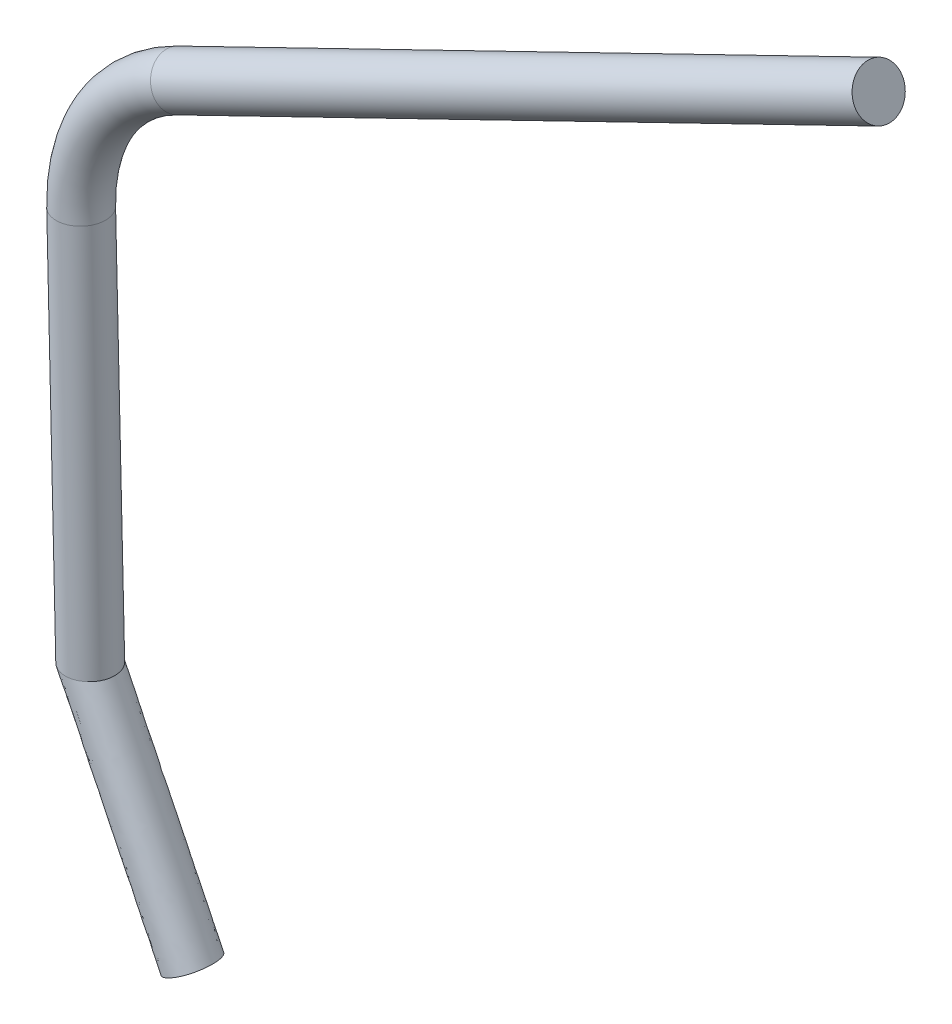
from build123d import *

# Parameters (mm, degrees)
SKETCH5_R               = 12.7
SKETCH6_R               = 12.7
BOSS_EXTRUDE3_DEPTH     = 406.4
SKETCH7_R               = 12.7
BOSS_EXTRUDE4_DEPTH     = 203.2
SKETCH9_R               = 12.065
CUT_EXTRUDE2_DEPTH      = 6.35
SKETCH10_R              = 12.7
CUT_EXTRUDE3_DEPTH      = 462.222817168
CUT_EXTRUDE3_DEPTH_BACK = 462.222817168


with BuildPart() as part:
    # Sweep1: sweep along a path in Sketch4
    with BuildLine(Plane.XY) as sweep1_path:
        ThreePointArc((-38.874671546, 79.949796199), (-75.907697444, 46.273442371), (-88.87582946, -2.072905643))
    # Sketch5 → Sweep1 (sweep)
    with BuildSketch(Plane(origin=(0, 0, 0), x_dir=(1, 0, 0), z_dir=(0, 1, 0))):
        with Locations((-88.87582946, 0)):
            Circle(SKETCH5_R)
    sweep(path=sweep1_path.line)

    # Sketch6 → Boss-Extrude3 (add)
    with BuildSketch(Plane(origin=(0, 0, 0), x_dir=(0, 0, -1), z_dir=(0.8993227918843839, 0.43728539421901275, 0))):
        with Locations((0, 88.87582946)):
            Circle(SKETCH6_R)
    extrude(amount=BOSS_EXTRUDE3_DEPTH)

    # Sketch7 → Boss-Extrude4 (add)
    with BuildSketch(Plane(origin=(0, 0, 0), x_dir=(-0.9997281154099812, -0.023317273828803834, 0), z_dir=(0.023317273828803834, -0.9997281154099812, 0))):
        with Locations((88.87582946, 0)):
            Circle(SKETCH7_R)
    extrude(amount=BOSS_EXTRUDE4_DEPTH)

    # Sketch9 → Cut-Extrude2 (cut)
    with BuildSketch(Plane(origin=(0, 0, -12.7), x_dir=(-1, 0, 0), z_dir=(0, 0, -1))):
        with Locations((76.269889492, 46.494235168)):
            Circle(SKETCH9_R)
    extrude(amount=-CUT_EXTRUDE2_DEPTH, mode=Mode.SUBTRACT)

    # Sweep2: sweep along a path in Sketch11
    with BuildLine(Plane.XY) as sweep2_path:
        Line((-84.113595449, -205.217095104), (-28.578350384, -319.431089673))
    # Sketch10 → Sweep2 (sweep)
    with BuildSketch(Plane(origin=(4.738070042, -203.144753051, 0), x_dir=(-0.9997281154099812, -0.023317273828803834, 0), z_dir=(0.023317273828803834, -0.9997281154099812, 0))):
        with Locations((88.87582946, 0)):
            Circle(SKETCH10_R)
    sweep(path=sweep2_path.line)

    # Sketch12 → Cut-Extrude3 (cut, two sides: drawn at the far end of the back side and taken through both)
    with BuildSketch(Plane.XY.offset(-CUT_EXTRUDE3_DEPTH_BACK)):
        Polygon((-41.274897449, -319.727219051), (-20.504520989, -309.627861689), (-15.881803318, -319.134960295), align=None)
    extrude(amount=CUT_EXTRUDE3_DEPTH + CUT_EXTRUDE3_DEPTH_BACK, mode=Mode.SUBTRACT)


solid = part.part
